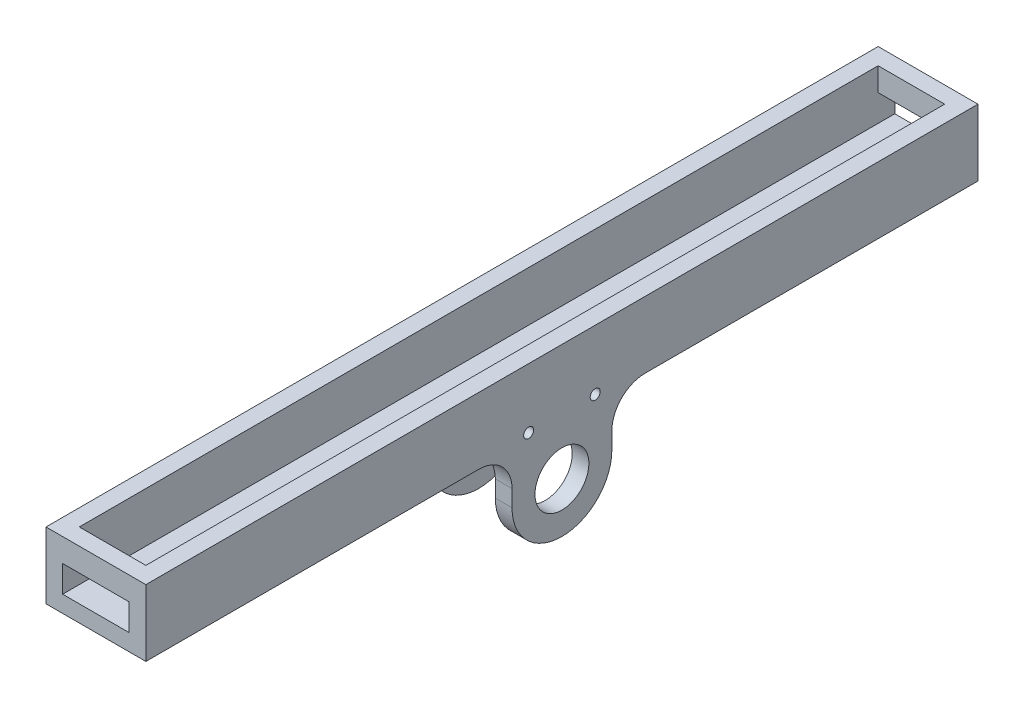
from build123d import *

# Parameters (mm, degrees)
BOSS_EXTRUDE1_DEPTH = 250
BOSS_EXTRUDE3_START = -17.1
SKETCH3_W           = 10
SKETCH3_H           = 10
SKETCH3_R           = 1.75
BOSS_EXTRUDE3_DEPTH = 7
FILLET1_R           = 5
SKETCH5_R           = 1.5
CUT_EXTRUDE1_DEPTH  = 7
SKETCH6_W           = 20
SKETCH6_H           = 5
BOSS_EXTRUDE4_DEPTH = 7
SKETCH2_R           = 8.1
BOSS_EXTRUDE5_DEPTH = 5
BOSS_EXTRUDE6_START = -25
SKETCH2_3_R         = 8.1
BOSS_EXTRUDE6_DEPTH = 5
SKETCH7_R           = 1.5
CUT_EXTRUDE2_DEPTH  = 254.574446662


with BuildPart() as part:
    # Sketch1 → Boss-Extrude1 (new body)
    with BuildSketch(Plane.XY):
        Polygon((25, 20), (30, 20), (30, 0), (0, 0), (0, 20), (5, 20), (5, 5), (25, 5), align=None)
    extrude(amount=BOSS_EXTRUDE1_DEPTH)

    # Sketch3 → Boss-Extrude3 (add)
    with BuildSketch(Plane(origin=(30, 0, 0), x_dir=(0, 0, -1), z_dir=(1, 0, 0)).offset(BOSS_EXTRUDE3_START)):
        with Locations((-220, -5)):
            Rectangle(SKETCH3_W, SKETCH3_H)
        with Locations(Location((-220, -5, 0), (0, 0, 90))):
            Circle(SKETCH3_R, mode=Mode.SUBTRACT)
    extrude(amount=BOSS_EXTRUDE3_DEPTH)

    # Fillet1
    fillet1_edges = [part.edges().sort_by_distance(p)[0] for p in [
        (16.4, -10, 215),
        (16.4, -10, 225),
    ]]
    fillet(fillet1_edges, radius=FILLET1_R - 0.0001)  # a hair under: the kernel refuses the full size

    # Sketch5 → Cut-Extrude1 (cut)
    with BuildSketch(Plane(origin=(0, 5, 0), x_dir=(1, 0, 0), z_dir=(0, 1, 0))):
        with Locations(Location((15, -230, 0), (0, 0, 270))):
            Circle(SKETCH5_R)
        with Locations(Location((15, -210, 0), (0, 0, 270))):
            Circle(SKETCH5_R)
        with Locations(Location((15, -40, 0), (0, 0, 270))):
            Circle(SKETCH5_R)
        with Locations(Location((15, -20, 0), (0, 0, 270))):
            Circle(SKETCH5_R)
    extrude(amount=-CUT_EXTRUDE1_DEPTH, mode=Mode.SUBTRACT)

    # Sketch6 → Boss-Extrude4 (add)
    with BuildSketch(Plane(origin=(0, 20, 0), x_dir=(1, 0, 0), z_dir=(0, 1, 0))):
        with Locations((15, -2.5)):
            Rectangle(SKETCH6_W, SKETCH6_H)
        with Locations((15, -247.5)):
            Rectangle(SKETCH6_W, SKETCH6_H)
    extrude(amount=-BOSS_EXTRUDE4_DEPTH)

    # Sketch2 → Boss-Extrude5 (add)
    with BuildSketch(Plane(origin=(30, 0, 0), x_dir=(0, 0, -1), z_dir=(1, 0, 0))):
        with BuildLine():
            Line((-140, -15), (-140, -10))
            ThreePointArc((-140, -10), (-142.928932188, -2.928932188), (-150, 0))
            Line((-150, 0), (-100, 0))
            ThreePointArc((-100, 0), (-107.071067812, -2.928932188), (-110, -10))
            Line((-110, -10), (-110, -15))
            ThreePointArc((-110, -15), (-125, -30), (-140, -15))
        make_face()
        with Locations(Location((-125, -15, 0), (0, 0, 90))):
            Circle(SKETCH2_R, mode=Mode.SUBTRACT)
    extrude(amount=-BOSS_EXTRUDE5_DEPTH)

    # Sketch2<3> → Boss-Extrude6 (add)
    with BuildSketch(Plane(origin=(30, 0, 0), x_dir=(0, 0, -1), z_dir=(1, 0, 0)).offset(BOSS_EXTRUDE6_START)):
        with BuildLine():
            Line((-140, -15), (-140, -10))
            ThreePointArc((-140, -10), (-142.928932188, -2.928932188), (-150, 0))
            Line((-150, 0), (-100, 0))
            ThreePointArc((-100, 0), (-107.071067812, -2.928932188), (-110, -10))
            Line((-110, -10), (-110, -15))
            ThreePointArc((-110, -15), (-125, -30), (-140, -15))
        make_face()
        with Locations(Location((-125, -15, 0), (0, 0, 90))):
            Circle(SKETCH2_3_R, mode=Mode.SUBTRACT)
    extrude(amount=-BOSS_EXTRUDE6_DEPTH)

    # Sketch7 → Cut-Extrude2 (cut, through all)
    with BuildSketch(Plane.ZY):
        with Locations((115, 2)):
            Circle(SKETCH7_R)
        with Locations((135, 2)):
            Circle(SKETCH7_R)
    extrude(amount=-CUT_EXTRUDE2_DEPTH, mode=Mode.SUBTRACT)


solid = part.part
